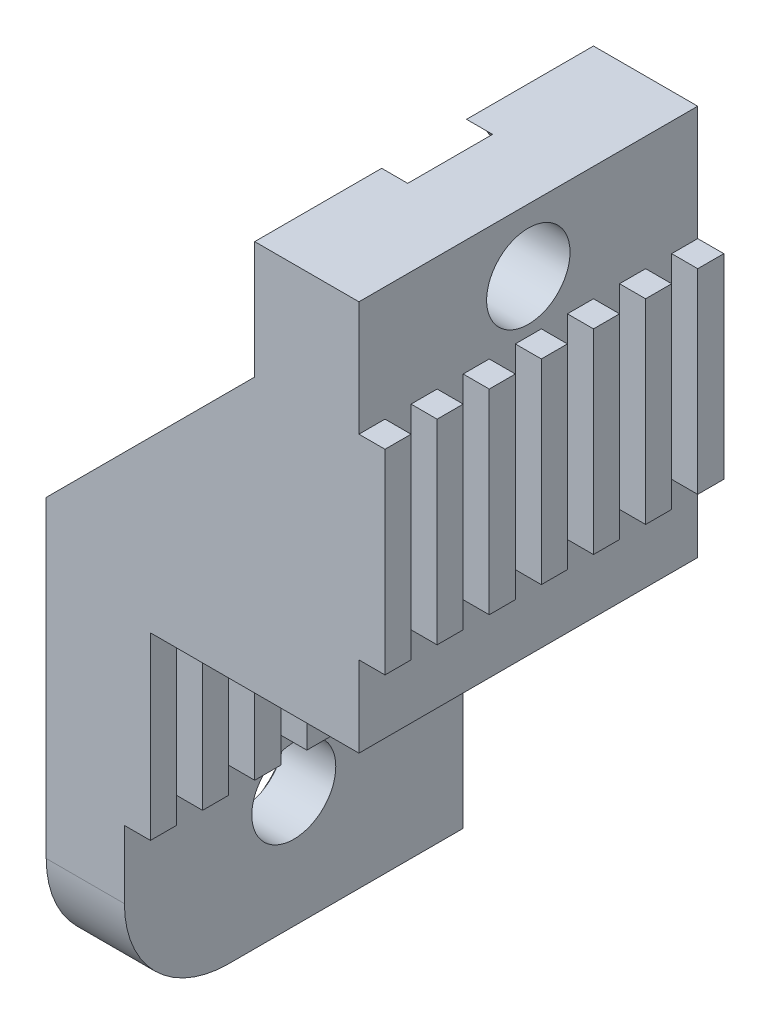
from build123d import *

# Parameters (mm, degrees)
BOSS_EXTRUDE1_DEPTH = 13
SKETCH2_R           = 1.6
SKETCH2_R_2         = 1.611537585
CUT_EXTRUDE1_DEPTH  = 20
SKETCH3_R           = 3
CUT_EXTRUDE2_DEPTH  = 1
SKETCH4_R           = 2.9
CUT_EXTRUDE3_DEPTH  = 1
SKETCH5_W           = 1
SKETCH5_H           = 7.5
BOSS_EXTRUDE2_DEPTH = 1
LPATTERN1_COUNT     = 7
LPATTERN1_PITCH     = 2
SKETCH6_W           = 1
SKETCH6_H           = 7.5
BOSS_EXTRUDE3_DEPTH = 1
LPATTERN2_COUNT     = 7
LPATTERN2_PITCH     = 2
CHAMFER1_SIZE       = 10
FILLET1_R           = 4


with BuildPart() as part:
    # Sketch1 → Boss-Extrude1 (new body)
    with BuildSketch(Plane.XY.offset(98.171636097)):
        Polygon((31.214370899, 78.263460463), (35.214370899, 78.263460463), (35.214370899, 66.863460463), (35.214370899, 63.263460463), (26.214370899, 63.263460463), (26.214370899, 49.763460463), (23.214370899, 49.763460463), (23.214370899, 63.263460463), (23.214370899, 63.763460463), (31.214370899, 63.763460463), align=None)
    extrude(amount=-BOSS_EXTRUDE1_DEPTH)

    # Sketch2 → Cut-Extrude1 (cut)
    with BuildSketch(Plane(origin=(35.214370899, 0, 0), x_dir=(0, 0, -1), z_dir=(1, 0, 0))):
        with Locations((-91.671636097, 75.863460463)):
            Circle(SKETCH2_R)
        with Locations((-91.671636097, 54.263460463)):
            Circle(SKETCH2_R_2)
    extrude(amount=-CUT_EXTRUDE1_DEPTH, mode=Mode.SUBTRACT)

    # Sketch3 → Cut-Extrude2 (cut)
    with BuildSketch(Plane.ZY.offset(-23.214370899)):
        with Locations((91.671636097, 54.263460463)):
            Circle(SKETCH3_R)
    extrude(amount=-CUT_EXTRUDE2_DEPTH, mode=Mode.SUBTRACT)

    # Sketch4 → Cut-Extrude3 (cut)
    with BuildSketch(Plane.ZY.offset(-31.214370899)):
        with Locations((91.671636097, 75.863460463)):
            Circle(SKETCH4_R)
    extrude(amount=-CUT_EXTRUDE3_DEPTH, mode=Mode.SUBTRACT)

    # Sketch5 → Boss-Extrude2 (add)
    with BuildSketch(Plane(origin=(35.214370899, 0, 0), x_dir=(0, 0, -1), z_dir=(1, 0, 0))):
        with Locations((-97.671636097, 70.113460463)):
            Rectangle(SKETCH5_W, SKETCH5_H)
    boss_extrude2 = extrude(amount=BOSS_EXTRUDE2_DEPTH)

    # LPattern1: Boss-Extrude2 ×7
    with Locations(*[(0, 0, -i * LPATTERN1_PITCH) for i in range(1, LPATTERN1_COUNT)]):
        add(boss_extrude2)

    # Sketch6 → Boss-Extrude3 (add)
    with BuildSketch(Plane(origin=(26.214370899, 0, 0), x_dir=(0, 0, -1), z_dir=(1, 0, 0))):
        with Locations((-97.671636097, 60.113460463)):
            Rectangle(SKETCH6_W, SKETCH6_H)
    boss_extrude3 = extrude(amount=BOSS_EXTRUDE3_DEPTH)

    # LPattern2: Boss-Extrude3 ×7
    with Locations(*[(0, 0, -i * LPATTERN2_PITCH) for i in range(1, LPATTERN2_COUNT)]):
        add(boss_extrude3)

    # Chamfer1
    # the kernel refuses this chamfer: 10 mm, written as the material it adds along each edge
    with BuildSketch(Plane(origin=(31.214370899, 63.763460463, 98.171636097), x_dir=(0.027495876610585647, 0.9996219169112968, 0), z_dir=(0, 0, -1))) as chamfer1_piece_1_section:
        Polygon((CHAMFER1_SIZE * 0.999621916911, -CHAMFER1_SIZE * 0.0274958766106), (-CHAMFER1_SIZE * 0.0274958766106, -CHAMFER1_SIZE * 0.999621916911), (0, 0), align=None)
    chamfer1_piece_1 = extrude(amount=13, mode=Mode.PRIVATE)
    chamfer1_piece_1 = chamfer1_piece_1 - Plane(origin=(28.210743814, 75.863460463, 91.671636097), x_dir=(0, 0, 1), z_dir=(-1, 0, 0)) * Cylinder(2.9, 66, mode=Mode.PRIVATE)
    chamfer1_piece_1 = split(chamfer1_piece_1, bisect_by=Plane(origin=(23.214370899, 67.201513325, 91.671636099), z_dir=(1, 0, 0)), keep=Keep.TOP, mode=Mode.PRIVATE)
    add(chamfer1_piece_1)

    # Fillet1
    fillet1_edges = [part.edges().sort_by_distance(p)[0] for p in [
        (24.714370899, 49.763460463, 98.171636097),
    ]]
    fillet(fillet1_edges, radius=FILLET1_R)


solid = part.part
